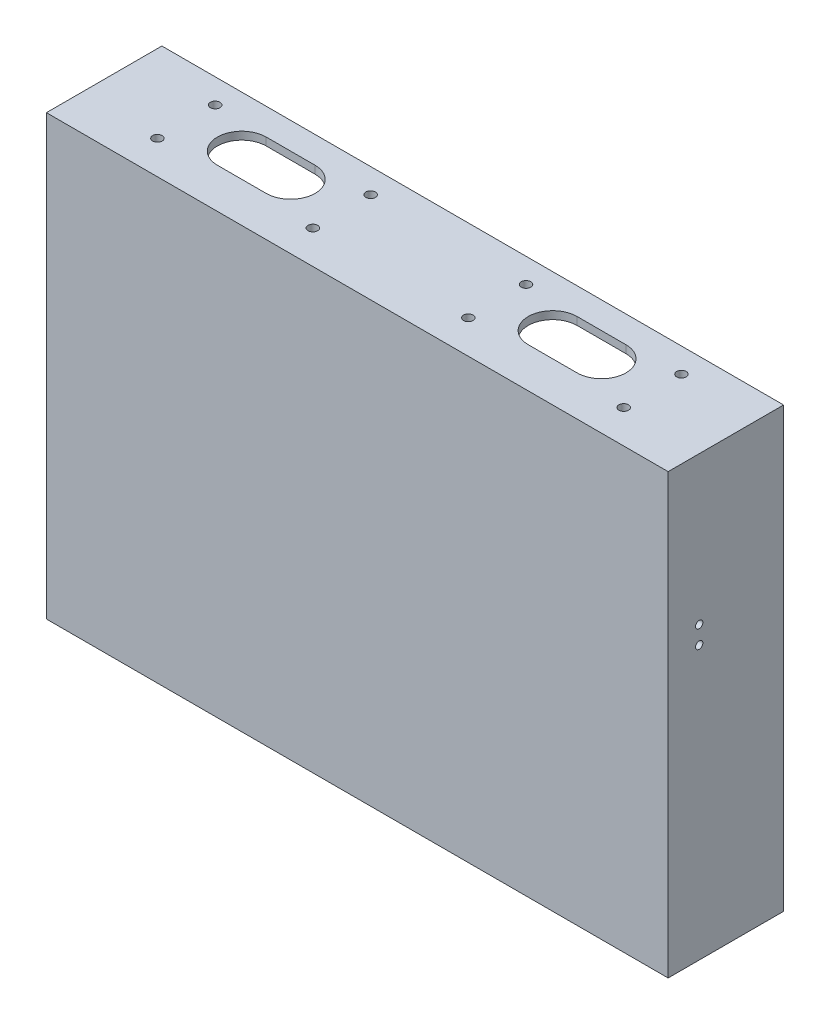
from build123d import *

# Parameters (mm, degrees)
SKETCH1_W                      = 280
SKETCH1_H                      = 52
PLACA_DEPTH                    = 3.5
VENAS_APOYO_DEPTH              = 191
SKETCH3_W                      = 280
SKETCH3_H                      = 52
TAPA_EXTERIOR_DEPTH            = 3
CUT_EXTRUDE3_REACH             = 255.664
PASACABLES_ENTRE_CAJAS_DEPTH   = 347.059243483
F_2_5_3_DIAMETER_HOLE1_D       = 3
F_2_5_3_DIAMETER_HOLE1_DEPTH   = 10
F_4_3_4_3_DIAMETER_HOLE1_D     = 4.3
F_4_3_4_3_DIAMETER_HOLE1_DEPTH = 3.5
CUT_EXTRUDE5_REACH             = 352.319
SKETCH18_R                     = 1.8
SKETCH18_W                     = 12.5
SKETCH18_H                     = 14
SKETCH19_R                     = 3
SKETCH19_R_2                   = 1.6
BOSS_EXTRUDE2_DEPTH            = 5
FILLET1_R                      = 3
SKETCH20_R                     = 1.65
CUT_EXTRUDE6_DEPTH             = 351.318783396


with BuildPart() as part:
    # Sketch1 → Placa (new body)
    with BuildSketch(Plane.XZ.offset(-198)):
        with Locations((140, 35)):
            Rectangle(SKETCH1_W, SKETCH1_H)
    extrude(amount=-PLACA_DEPTH)

    # Sketch2 → Venas apoyo (add)
    with BuildSketch(Plane.XZ.offset(-198)):
        Polygon((271.25, 9), (271.25, 17), (277, 22.75), (277, 58), (141.5, 58), (141.5, 24.25), (148.75, 17), (148.75, 9), (131.25, 9), (131.25, 17), (138.5, 24.25), (138.5, 58), (3, 58), (3, 22.75), (8.75, 17), (8.75, 9), (0, 9), (0, 61), (280, 61), (280, 9), align=None)
    extrude(amount=VENAS_APOYO_DEPTH)

    # Sketch3 → Tapa exterior (add)
    with BuildSketch(Plane.XZ.offset(-7)):
        with Locations((140, 35)):
            Rectangle(SKETCH3_W, SKETCH3_H)
    extrude(amount=TAPA_EXTERIOR_DEPTH)

    # Sketch8 → Cut-Extrude3 (cut, up to next)
    with BuildSketch(Plane(origin=(141.5, 0, 0), x_dir=(0, 0, -1), z_dir=(1, 0, 0)), mode=Mode.PRIVATE) as cut_extrude3_sk1:
        with BuildLine():
            Line((-55, 156), (-55, 142))
            ThreePointArc((-55, 142), (-42, 129), (-29, 142))
            Line((-29, 142), (-29, 156))
            ThreePointArc((-29, 156), (-42, 169), (-55, 156))
        make_face()
    cut_extrude3_tool1 = extrude(cut_extrude3_sk1.sketch, amount=-CUT_EXTRUDE3_REACH, mode=Mode.PRIVATE) & part.part
    # Sketch8 → Cut-Extrude3 (cut, up to next)
    with BuildSketch(Plane(origin=(141.5, 0, 0), x_dir=(0, 0, -1), z_dir=(1, 0, 0)), mode=Mode.PRIVATE) as cut_extrude3_sk2:
        with BuildLine():
            Line((-55, 49), (-55, 63))
            ThreePointArc((-55, 63), (-42, 76), (-29, 63))
            Line((-29, 63), (-29, 49))
            ThreePointArc((-29, 49), (-42, 36), (-55, 49))
        make_face()
    cut_extrude3_tool2 = extrude(cut_extrude3_sk2.sketch, amount=-CUT_EXTRUDE3_REACH, mode=Mode.PRIVATE) & part.part
    add(cut_extrude3_tool1.solids().sort_by_distance((141.5, 149, 42))[0], mode=Mode.SUBTRACT)
    add(cut_extrude3_tool2.solids().sort_by_distance((141.5, 56, 42))[0], mode=Mode.SUBTRACT)

    # Sketch9 → Pasacables entre cajas (cut, through all)
    with BuildSketch(Plane.XZ.offset(-198)):
        with BuildLine():
            Line((221, 43), (199, 43))
            ThreePointArc((199, 43), (188, 32), (199, 21))
            Line((199, 21), (221, 21))
            ThreePointArc((221, 21), (232, 32), (221, 43))
        make_face()
        with BuildLine():
            Line((81, 43), (59, 43))
            ThreePointArc((59, 43), (48, 32), (59, 21))
            Line((59, 21), (81, 21))
            ThreePointArc((81, 21), (92, 32), (81, 43))
        make_face()
    extrude(amount=-PASACABLES_ENTRE_CAJAS_DEPTH, mode=Mode.SUBTRACT)

    # Ø2.5 (3) Diameter Hole1
    with Locations(Plane(origin=(0, 0, 9), x_dir=(-1, 0, 0), z_dir=(0, 0, -1))):
        with Locations((-275.5, 187), (-275.5, 165), (-144.5, 187), (-144.5, 165), (-275.5, 143), (-275.5, 121), (-144.5, 143), (-144.5, 121), (-135.5, 187), (-135.5, 165), (-4.5, 187), (-4.5, 165), (-135.5, 143), (-135.5, 121), (-4.5, 143), (-4.5, 121), (-275.5, 99), (-275.5, 77), (-275.5, 55), (-144.5, 99), (-144.5, 77), (-144.5, 55), (-275.5, 33), (-275.5, 11), (-144.5, 33), (-144.5, 11), (-135.5, 99), (-135.5, 77), (-135.5, 55), (-4.5, 99), (-4.5, 77), (-4.5, 55), (-135.5, 33), (-135.5, 11), (-4.5, 33), (-4.5, 11)):
            Hole(F_2_5_3_DIAMETER_HOLE1_D / 2, depth=F_2_5_3_DIAMETER_HOLE1_DEPTH)

    # Ø4.3 (4.3) Diameter Hole1
    with Locations(Plane(origin=(0, 201.5, 0), x_dir=(1, 0, 0), z_dir=(0, 1, 0))):
        with Locations((245, -46), (175, -46), (245, -20), (175, -20), (105, -46), (35, -46), (105, -20), (35, -20)):
            Hole(F_4_3_4_3_DIAMETER_HOLE1_D / 2, depth=F_4_3_4_3_DIAMETER_HOLE1_DEPTH)

    # Sketch18 → Cut-Extrude5 (cut, up to next)
    with BuildSketch(Plane.ZY, mode=Mode.PRIVATE) as cut_extrude5_sk1:
        with Locations((48.846390914, 69.6645124)):
            Circle(SKETCH18_R)
    cut_extrude5_tool1 = extrude(cut_extrude5_sk1.sketch, amount=-CUT_EXTRUDE5_REACH, mode=Mode.PRIVATE) & part.part
    # Sketch18 → Cut-Extrude5 (cut, up to next)
    with BuildSketch(Plane.ZY, mode=Mode.PRIVATE) as cut_extrude5_sk2:
        with Locations((45.308565255, 32.367203064)):
            Rectangle(SKETCH18_W, SKETCH18_H)
    cut_extrude5_tool2 = extrude(cut_extrude5_sk2.sketch, amount=-CUT_EXTRUDE5_REACH, mode=Mode.PRIVATE) & part.part
    add(cut_extrude5_tool1.solids().sort_by_distance((0, 69.664512, 48.846391))[0], mode=Mode.SUBTRACT)
    add(cut_extrude5_tool2.solids().sort_by_distance((0, 32.367203, 45.308565))[0], mode=Mode.SUBTRACT)

    # Sketch19 → Boss-Extrude2 (add)
    # profile 1 of 20: a face of its own
    with BuildSketch(Plane(origin=(0, 0, 58), x_dir=(-1, 0, 0), z_dir=(0, 0, -1))):
        with Locations(Location((-67.205, 76.283, 0), (0, 0, 180))):
            Circle(SKETCH19_R)
        with Locations((-67.205, 76.283)):
            Circle(SKETCH19_R_2, mode=Mode.SUBTRACT)
    # profile 2 of 20: a face of its own
    with BuildSketch(Plane(origin=(0, 0, 58), x_dir=(-1, 0, 0), z_dir=(0, 0, -1))):
        with Locations(Location((-67.205, 20.674, 0), (0, 0, 180))):
            Circle(SKETCH19_R)
        with Locations((-67.205, 20.674)):
            Circle(SKETCH19_R_2, mode=Mode.SUBTRACT)
    # profile 3 of 20: a face of its own
    with BuildSketch(Plane(origin=(0, 0, 58), x_dir=(-1, 0, 0), z_dir=(0, 0, -1))):
        with Locations(Location((-7.81, 76.283, 0), (0, 0, 180))):
            Circle(SKETCH19_R)
        with Locations((-7.81, 76.283)):
            Circle(SKETCH19_R_2, mode=Mode.SUBTRACT)
    # profile 4 of 20: a face of its own
    with BuildSketch(Plane(origin=(0, 0, 58), x_dir=(-1, 0, 0), z_dir=(0, 0, -1))):
        with Locations(Location((-7.81, 20.674, 0), (0, 0, 180))):
            Circle(SKETCH19_R)
        with Locations((-7.81, 20.674)):
            Circle(SKETCH19_R_2, mode=Mode.SUBTRACT)
    # profile 5 of 20: a face of its own
    with BuildSketch(Plane(origin=(0, 0, 58), x_dir=(-1, 0, 0), z_dir=(0, 0, -1))):
        with Locations(Location((-96.537437962, 88.916879854, 0), (0, 0, 180))):
            Circle(SKETCH19_R)
        with Locations((-96.537437962, 88.916879854)):
            Circle(SKETCH19_R_2, mode=Mode.SUBTRACT)
    # profile 6 of 20: a face of its own
    with BuildSketch(Plane(origin=(0, 0, 58), x_dir=(-1, 0, 0), z_dir=(0, 0, -1))):
        with Locations(Location((-42.308437962, 88.916879854, 0), (0, 0, 180))):
            Circle(SKETCH19_R)
        with Locations((-42.308437962, 88.916879854)):
            Circle(SKETCH19_R_2, mode=Mode.SUBTRACT)
    # profile 7 of 20: a face of its own
    with BuildSketch(Plane(origin=(0, 0, 58), x_dir=(-1, 0, 0), z_dir=(0, 0, -1))):
        with Locations(Location((-42.308437962, 125.222879854, 0), (0, 0, 180))):
            Circle(SKETCH19_R)
        with Locations((-42.308437962, 125.222879854)):
            Circle(SKETCH19_R_2, mode=Mode.SUBTRACT)
    # profile 8 of 20: a face of its own
    with BuildSketch(Plane(origin=(0, 0, 58), x_dir=(-1, 0, 0), z_dir=(0, 0, -1))):
        with Locations(Location((-96.537437962, 125.222879854, 0), (0, 0, 180))):
            Circle(SKETCH19_R)
        with Locations((-96.537437962, 125.222879854)):
            Circle(SKETCH19_R_2, mode=Mode.SUBTRACT)
    # profile 9 of 20: a face of its own
    with BuildSketch(Plane(origin=(0, 0, 58), x_dir=(-1, 0, 0), z_dir=(0, 0, -1))):
        with Locations(Location((-96.537437962, 148.21342376, 0), (0, 0, 180))):
            Circle(SKETCH19_R)
        with Locations((-96.537437962, 148.21342376)):
            Circle(SKETCH19_R_2, mode=Mode.SUBTRACT)
    # profile 10 of 20: a face of its own
    with BuildSketch(Plane(origin=(0, 0, 58), x_dir=(-1, 0, 0), z_dir=(0, 0, -1))):
        with Locations(Location((-42.308437962, 148.21342376, 0), (0, 0, 180))):
            Circle(SKETCH19_R)
        with Locations((-42.308437962, 148.21342376)):
            Circle(SKETCH19_R_2, mode=Mode.SUBTRACT)
    # profile 11 of 20: a face of its own
    with BuildSketch(Plane(origin=(0, 0, 58), x_dir=(-1, 0, 0), z_dir=(0, 0, -1))):
        with Locations(Location((-42.308437962, 184.51942376, 0), (0, 0, 180))):
            Circle(SKETCH19_R)
        with Locations((-42.308437962, 184.51942376)):
            Circle(SKETCH19_R_2, mode=Mode.SUBTRACT)
    # profile 12 of 20: a face of its own
    with BuildSketch(Plane(origin=(0, 0, 58), x_dir=(-1, 0, 0), z_dir=(0, 0, -1))):
        with Locations(Location((-96.537437962, 184.51942376, 0), (0, 0, 180))):
            Circle(SKETCH19_R)
        with Locations((-96.537437962, 184.51942376)):
            Circle(SKETCH19_R_2, mode=Mode.SUBTRACT)
    # profile 13 of 20: a face of its own
    with BuildSketch(Plane(origin=(0, 0, 58), x_dir=(-1, 0, 0), z_dir=(0, 0, -1))):
        with Locations(Location((-184.693258381, 175.46, 0), (0, 0, 180))):
            Circle(SKETCH19_R)
        with Locations((-184.693258381, 175.46)):
            Circle(SKETCH19_R_2, mode=Mode.SUBTRACT)
    # profile 14 of 20: a face of its own
    with BuildSketch(Plane(origin=(0, 0, 58), x_dir=(-1, 0, 0), z_dir=(0, 0, -1))):
        with Locations(Location((-184.693258381, 139.154, 0), (0, 0, 180))):
            Circle(SKETCH19_R)
        with Locations((-184.693258381, 139.154)):
            Circle(SKETCH19_R_2, mode=Mode.SUBTRACT)
    # profile 15 of 20: a face of its own
    with BuildSketch(Plane(origin=(0, 0, 58), x_dir=(-1, 0, 0), z_dir=(0, 0, -1))):
        with Locations(Location((-238.922258381, 139.154, 0), (0, 0, 180))):
            Circle(SKETCH19_R)
        with Locations((-238.922258381, 139.154)):
            Circle(SKETCH19_R_2, mode=Mode.SUBTRACT)
    # profile 16 of 20: a face of its own
    with BuildSketch(Plane(origin=(0, 0, 58), x_dir=(-1, 0, 0), z_dir=(0, 0, -1))):
        with Locations(Location((-238.922258381, 175.46, 0), (0, 0, 180))):
            Circle(SKETCH19_R)
        with Locations((-238.922258381, 175.46)):
            Circle(SKETCH19_R_2, mode=Mode.SUBTRACT)
    # profile 17 of 20: a face of its own
    with BuildSketch(Plane(origin=(0, 0, 58), x_dir=(-1, 0, 0), z_dir=(0, 0, -1))):
        with Locations(Location((-238.922258381, 88.173467564, 0), (0, 0, 180))):
            Circle(SKETCH19_R)
        with Locations((-238.922258381, 88.173467564)):
            Circle(SKETCH19_R_2, mode=Mode.SUBTRACT)
    # profile 18 of 20: a face of its own
    with BuildSketch(Plane(origin=(0, 0, 58), x_dir=(-1, 0, 0), z_dir=(0, 0, -1))):
        with Locations(Location((-184.693258381, 88.173467564, 0), (0, 0, 180))):
            Circle(SKETCH19_R)
        with Locations((-184.693258381, 88.173467564)):
            Circle(SKETCH19_R_2, mode=Mode.SUBTRACT)
    # profile 19 of 20: a face of its own
    with BuildSketch(Plane(origin=(0, 0, 58), x_dir=(-1, 0, 0), z_dir=(0, 0, -1))):
        with Locations(Location((-184.693258381, 51.867467564, 0), (0, 0, 180))):
            Circle(SKETCH19_R)
        with Locations((-184.693258381, 51.867467564)):
            Circle(SKETCH19_R_2, mode=Mode.SUBTRACT)
    # profile 20 of 20: a face of its own
    with BuildSketch(Plane(origin=(0, 0, 58), x_dir=(-1, 0, 0), z_dir=(0, 0, -1))):
        with Locations(Location((-238.922258381, 51.867467564, 0), (0, 0, 180))):
            Circle(SKETCH19_R)
        with Locations((-238.922258381, 51.867467564)):
            Circle(SKETCH19_R_2, mode=Mode.SUBTRACT)
    extrude(amount=BOSS_EXTRUDE2_DEPTH)

    # Fillet1
    # the kernel refuses this fillet: 3 mm, written as the material it adds along each edge
    with BuildSketch(Plane(origin=(238.922258381, 51.867467564, 58), x_dir=(1, 0, 0), z_dir=(0, 1, 0))) as fillet1_piece_1:
        with BuildLine():
            CenterArc((3 + FILLET1_R, FILLET1_R), FILLET1_R, 180, 90)
            Line((3, FILLET1_R), (3, 0))
            Line((3, 0), (3 + FILLET1_R, 0))
        make_face()
    revolve(axis=Axis((238.922258381, 51.867467564, 58), (0, 0, -1)))
    with BuildSketch(Plane(origin=(184.693258381, 51.867467564, 58), x_dir=(1, 0, 0), z_dir=(0, 1, 0))) as fillet1_piece_2:
        with BuildLine():
            CenterArc((3 + FILLET1_R, FILLET1_R), FILLET1_R, 180, 90)
            Line((3, FILLET1_R), (3, 0))
            Line((3, 0), (3 + FILLET1_R, 0))
        make_face()
    revolve(axis=Axis((184.693258381, 51.867467564, 58), (0, 0, -1)))
    with BuildSketch(Plane(origin=(184.693258381, 88.173467564, 58), x_dir=(1, 0, 0), z_dir=(0, 1, 0))) as fillet1_piece_3:
        with BuildLine():
            CenterArc((3 + FILLET1_R, FILLET1_R), FILLET1_R, 180, 90)
            Line((3, FILLET1_R), (3, 0))
            Line((3, 0), (3 + FILLET1_R, 0))
        make_face()
    revolve(axis=Axis((184.693258381, 88.173467564, 58), (0, 0, -1)))
    with BuildSketch(Plane(origin=(184.693258381, 139.154, 58), x_dir=(1, 0, 0), z_dir=(0, 1, 0))) as fillet1_piece_4:
        with BuildLine():
            CenterArc((3 + FILLET1_R, FILLET1_R), FILLET1_R, 180, 90)
            Line((3, FILLET1_R), (3, 0))
            Line((3, 0), (3 + FILLET1_R, 0))
        make_face()
    revolve(axis=Axis((184.693258381, 139.154, 58), (0, 0, -1)))
    with BuildSketch(Plane(origin=(238.922258381, 139.154, 58), x_dir=(1, 0, 0), z_dir=(0, 1, 0))) as fillet1_piece_5:
        with BuildLine():
            CenterArc((3 + FILLET1_R, FILLET1_R), FILLET1_R, 180, 90)
            Line((3, FILLET1_R), (3, 0))
            Line((3, 0), (3 + FILLET1_R, 0))
        make_face()
    revolve(axis=Axis((238.922258381, 139.154, 58), (0, 0, -1)))
    with BuildSketch(Plane(origin=(238.922258381, 175.46, 58), x_dir=(1, 0, 0), z_dir=(0, 1, 0))) as fillet1_piece_6:
        with BuildLine():
            CenterArc((3 + FILLET1_R, FILLET1_R), FILLET1_R, 180, 90)
            Line((3, FILLET1_R), (3, 0))
            Line((3, 0), (3 + FILLET1_R, 0))
        make_face()
    revolve(axis=Axis((238.922258381, 175.46, 58), (0, 0, -1)))
    with BuildSketch(Plane(origin=(238.922258381, 88.173467564, 58), x_dir=(1, 0, 0), z_dir=(0, 1, 0))) as fillet1_piece_7:
        with BuildLine():
            CenterArc((3 + FILLET1_R, FILLET1_R), FILLET1_R, 180, 90)
            Line((3, FILLET1_R), (3, 0))
            Line((3, 0), (3 + FILLET1_R, 0))
        make_face()
    revolve(axis=Axis((238.922258381, 88.173467564, 58), (0, 0, -1)))
    with BuildSketch(Plane(origin=(184.693258381, 175.46, 58), x_dir=(1, 0, 0), z_dir=(0, 1, 0))) as fillet1_piece_8:
        with BuildLine():
            CenterArc((3 + FILLET1_R, FILLET1_R), FILLET1_R, 180, 90)
            Line((3, FILLET1_R), (3, 0))
            Line((3, 0), (3 + FILLET1_R, 0))
        make_face()
    revolve(axis=Axis((184.693258381, 175.46, 58), (0, 0, -1)))
    with BuildSketch(Plane(origin=(67.205, 76.283, 58), x_dir=(1, 0, 0), z_dir=(0, 1, 0))) as fillet1_piece_9:
        with BuildLine():
            CenterArc((3 + FILLET1_R, FILLET1_R), FILLET1_R, 180, 90)
            Line((3, FILLET1_R), (3, 0))
            Line((3, 0), (3 + FILLET1_R, 0))
        make_face()
    revolve(axis=Axis((67.205, 76.283, 58), (0, 0, -1)))
    with BuildSketch(Plane(origin=(96.537437962, 148.21342376, 58), x_dir=(1, 0, 0), z_dir=(0, 1, 0))) as fillet1_piece_10:
        with BuildLine():
            CenterArc((3 + FILLET1_R, FILLET1_R), FILLET1_R, 180, 90)
            Line((3, FILLET1_R), (3, 0))
            Line((3, 0), (3 + FILLET1_R, 0))
        make_face()
    revolve(axis=Axis((96.537437962, 148.21342376, 58), (0, 0, -1)))
    with BuildSketch(Plane(origin=(96.537437962, 125.222879854, 58), x_dir=(1, 0, 0), z_dir=(0, 1, 0))) as fillet1_piece_11:
        with BuildLine():
            CenterArc((3 + FILLET1_R, FILLET1_R), FILLET1_R, 180, 90)
            Line((3, FILLET1_R), (3, 0))
            Line((3, 0), (3 + FILLET1_R, 0))
        make_face()
    revolve(axis=Axis((96.537437962, 125.222879854, 58), (0, 0, -1)))
    with BuildSketch(Plane(origin=(42.308437962, 125.222879854, 58), x_dir=(1, 0, 0), z_dir=(0, 1, 0))) as fillet1_piece_12:
        with BuildLine():
            CenterArc((3 + FILLET1_R, FILLET1_R), FILLET1_R, 180, 90)
            Line((3, FILLET1_R), (3, 0))
            Line((3, 0), (3 + FILLET1_R, 0))
        make_face()
    revolve(axis=Axis((42.308437962, 125.222879854, 58), (0, 0, -1)))
    with BuildSketch(Plane(origin=(42.308437962, 88.916879854, 58), x_dir=(1, 0, 0), z_dir=(0, 1, 0))) as fillet1_piece_13:
        with BuildLine():
            CenterArc((3 + FILLET1_R, FILLET1_R), FILLET1_R, 180, 90)
            Line((3, FILLET1_R), (3, 0))
            Line((3, 0), (3 + FILLET1_R, 0))
        make_face()
    revolve(axis=Axis((42.308437962, 88.916879854, 58), (0, 0, -1)))
    with BuildSketch(Plane(origin=(67.205, 20.674, 58), x_dir=(1, 0, 0), z_dir=(0, 1, 0))) as fillet1_piece_14:
        with BuildLine():
            CenterArc((3 + FILLET1_R, FILLET1_R), FILLET1_R, 180, 90)
            Line((3, FILLET1_R), (3, 0))
            Line((3, 0), (3 + FILLET1_R, 0))
        make_face()
    revolve(axis=Axis((67.205, 20.674, 58), (0, 0, -1)))
    with BuildSketch(Plane(origin=(7.81, 76.283, 58), x_dir=(1, 0, 0), z_dir=(0, 1, 0))) as fillet1_piece_15:
        with BuildLine():
            CenterArc((3 + FILLET1_R, FILLET1_R), FILLET1_R, 180, 90)
            Line((3, FILLET1_R), (3, 0))
            Line((3, 0), (3 + FILLET1_R, 0))
        make_face()
    revolve(axis=Axis((7.81, 76.283, 58), (0, 0, -1)))
    with BuildSketch(Plane(origin=(7.81, 20.674, 58), x_dir=(1, 0, 0), z_dir=(0, 1, 0))) as fillet1_piece_16:
        with BuildLine():
            CenterArc((3 + FILLET1_R, FILLET1_R), FILLET1_R, 180, 90)
            Line((3, FILLET1_R), (3, 0))
            Line((3, 0), (3 + FILLET1_R, 0))
        make_face()
    revolve(axis=Axis((7.81, 20.674, 58), (0, 0, -1)))
    with BuildSketch(Plane(origin=(96.537437962, 88.916879854, 58), x_dir=(1, 0, 0), z_dir=(0, 1, 0))) as fillet1_piece_17:
        with BuildLine():
            CenterArc((3 + FILLET1_R, FILLET1_R), FILLET1_R, 180, 90)
            Line((3, FILLET1_R), (3, 0))
            Line((3, 0), (3 + FILLET1_R, 0))
        make_face()
    revolve(axis=Axis((96.537437962, 88.916879854, 58), (0, 0, -1)))
    with BuildSketch(Plane(origin=(96.537437962, 184.51942376, 58), x_dir=(1, 0, 0), z_dir=(0, 1, 0))) as fillet1_piece_18:
        with BuildLine():
            CenterArc((3 + FILLET1_R, FILLET1_R), FILLET1_R, 180, 90)
            Line((3, FILLET1_R), (3, 0))
            Line((3, 0), (3 + FILLET1_R, 0))
        make_face()
    revolve(axis=Axis((96.537437962, 184.51942376, 58), (0, 0, -1)))
    with BuildSketch(Plane(origin=(42.308437962, 184.51942376, 58), x_dir=(1, 0, 0), z_dir=(0, 1, 0))) as fillet1_piece_19:
        with BuildLine():
            CenterArc((3 + FILLET1_R, FILLET1_R), FILLET1_R, 180, 90)
            Line((3, FILLET1_R), (3, 0))
            Line((3, 0), (3 + FILLET1_R, 0))
        make_face()
    revolve(axis=Axis((42.308437962, 184.51942376, 58), (0, 0, -1)))
    with BuildSketch(Plane(origin=(42.308437962, 148.21342376, 58), x_dir=(1, 0, 0), z_dir=(0, 1, 0))) as fillet1_piece_20:
        with BuildLine():
            CenterArc((3 + FILLET1_R, FILLET1_R), FILLET1_R, 180, 90)
            Line((3, FILLET1_R), (3, 0))
            Line((3, 0), (3 + FILLET1_R, 0))
        make_face()
    revolve(axis=Axis((42.308437962, 148.21342376, 58), (0, 0, -1)))

    # Sketch20 → Cut-Extrude6 (cut, through all)
    with BuildSketch(Plane.ZY):
        with Locations((47, 134.856776801)):
            Circle(SKETCH20_R)
        with Locations((47, 126.856776801)):
            Circle(SKETCH20_R)
    extrude(amount=-CUT_EXTRUDE6_DEPTH, mode=Mode.SUBTRACT)


solid = part.part
